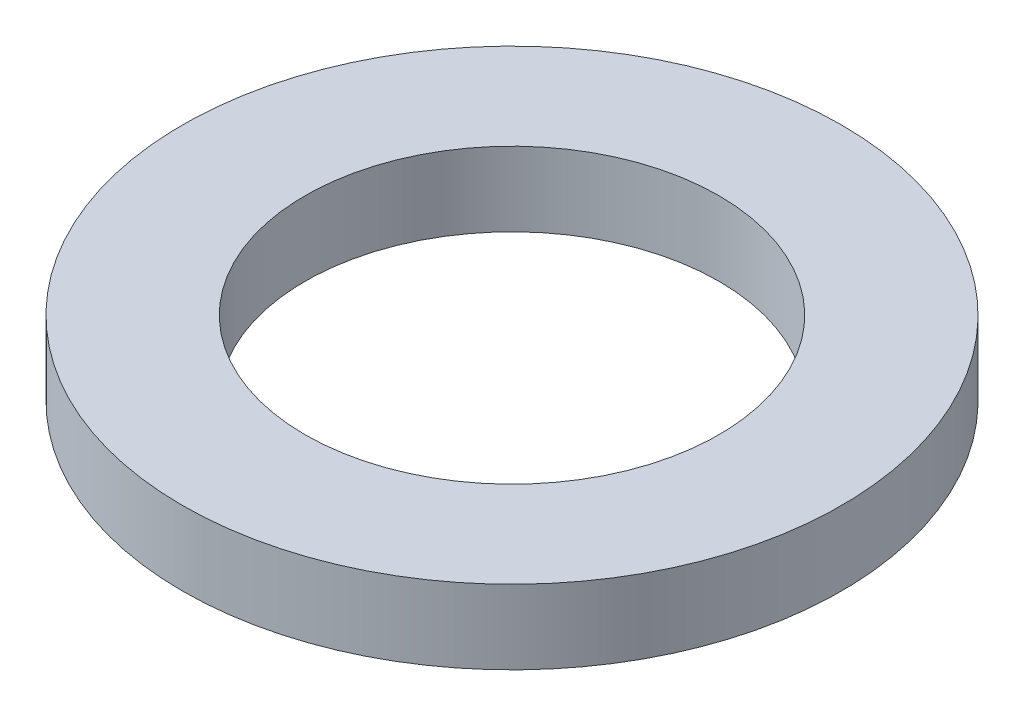
from build123d import *


with BuildPart() as part:
    # Sketch1 → Revolve1 (revolve)
    with BuildSketch(Plane.XY):
        Polygon((5.025, 0), (8, 0), (8, -1.8), (5.9, -1.8), (5.9, -2), (5.5, -2), (5.5, -1.8), (5.025, -1.8), align=None)
    revolve(axis=Axis((0, 0, 0), (0, -1, 0)))


solid = part.part
